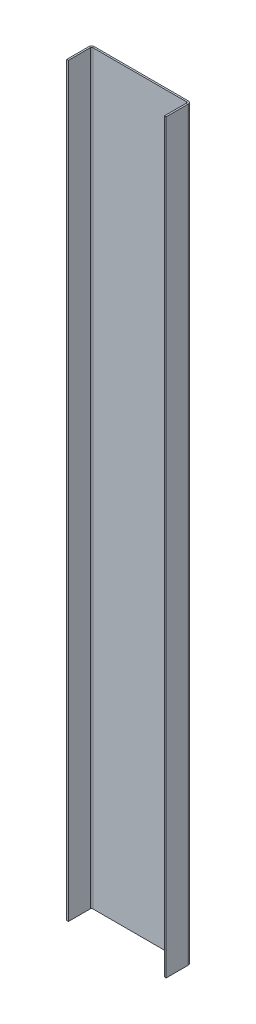
from build123d import *

# Parameters (mm, degrees)
SKETCH1_W                      = 60
SKETCH1_H                      = 450
BASE_FLANGE1_DEPTH             = 1
EDGE_FLANGE1_STRIP_W           = 5.4732
EDGE_FLANGE1_STRIP_H           = 1
EDGE_FLANGE1_STRIP_CUT_DEPTH   = 450
EDGE_FLANGE1_STRIP_2_W         = 5.4732
EDGE_FLANGE1_STRIP_2_H         = 1
EDGE_FLANGE1_STRIP_CUT_2_DEPTH = 450
EDGE_FLANGE1_DEPTH             = 450
EDGE_FLANGE1_BEND_DEPTH        = 450


# Sheet-metal steps are written as plain solids
with BuildPart() as part:
    # Sketch1 → Base-Flange1 (new body)
    with BuildSketch(Plane.XY):
        Rectangle(SKETCH1_W, SKETCH1_H)
    extrude(amount=-BASE_FLANGE1_DEPTH)

    # Edge-Flange1 strip (across the edge) → Edge-Flange1 strip cut (cut)
    with BuildSketch(Plane(origin=(30, -225, 0), x_dir=(-1, 0, 0), z_dir=(0, 1, 0))):
        with Locations((-1, -0.5)):
            Rectangle(EDGE_FLANGE1_STRIP_W, EDGE_FLANGE1_STRIP_H)
    extrude(amount=EDGE_FLANGE1_STRIP_CUT_DEPTH, mode=Mode.SUBTRACT)

    # Edge-Flange1 strip 2 (across the edge) → Edge-Flange1 strip cut 2 (cut)
    with BuildSketch(Plane(origin=(-30, 225, 0), x_dir=(1, 0, 0), z_dir=(0, -1, 0))):
        with Locations((-1, -0.5)):
            Rectangle(EDGE_FLANGE1_STRIP_2_W, EDGE_FLANGE1_STRIP_2_H)
    extrude(amount=EDGE_FLANGE1_STRIP_CUT_2_DEPTH, mode=Mode.SUBTRACT)

    # Edge-Flange1 section (across the edge) → Edge-Flange1 (add)
    with BuildSketch(Plane(origin=(30, -225, 0), x_dir=(-1, 0, 0), z_dir=(0, 1, 0))):
        with BuildLine():
            Line((0, 0.7366), (0, 14))
            Line((0, 14), (1, 14))
            Line((1, 14), (1, 0.7366))
            ThreePointArc((1, 0.7366), (1.215745145, 0.215745145), (1.7366, 0))
            Line((1.7366, 0), (1.7366, -1))
            ThreePointArc((1.7366, -1), (0.508638364, -0.491361636), (0, 0.7366))
        make_face()
    extrude(amount=EDGE_FLANGE1_DEPTH)

    # Edge-Flange1 section 2 (across the edge) → Edge-Flange1 bend (add)
    with BuildSketch(Plane(origin=(-30, 225, 0), x_dir=(1, 0, 0), z_dir=(0, -1, 0))):
        with BuildLine():
            Line((0, 0.7366), (0, 14))
            Line((0, 14), (1, 14))
            Line((1, 14), (1, 0.7366))
            ThreePointArc((1, 0.7366), (1.215745145, 0.215745145), (1.7366, 0))
            Line((1.7366, 0), (1.7366, -1))
            ThreePointArc((1.7366, -1), (0.508638364, -0.491361636), (0, 0.7366))
        make_face()
    extrude(amount=EDGE_FLANGE1_BEND_DEPTH)


solid = part.part
